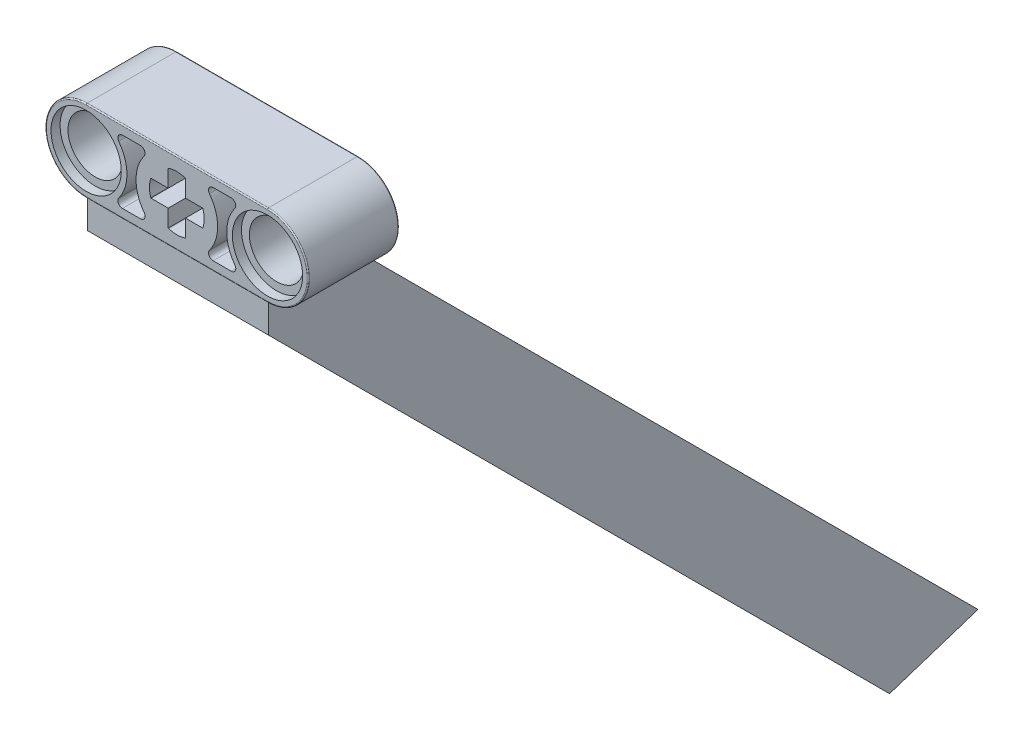
from build123d import *
from OCP.BRepAlgoAPI import BRepAlgoAPI_Cut
from OCP.TopTools import TopTools_ListOfShape

# Parameters (mm, degrees)
BOSS_EXTRUDE1_DEPTH   = 8
CUT_EXTRUDE2_DEPTH    = 3.1
CUT_EXTRUDE4_DEPTH    = 3.1
CUT_EXTRUDE6_START    = -3.1
CUT_EXTRUDE6_DEPTH    = 3.1
CUT_EXTRUDE7_START    = -3.1
CUT_EXTRUDE7_DEPTH    = 3.1
FILLET1_R             = 0.1
BODY_MOVE_COPY1_ANGLE = 89
BODY_MOVE_COPY3_ANGLE = 1
CUT_EXTRUDE8_DEPTH    = 19.406951047
CUT_EXTRUDE9_DEPTH    = 19.406951047
SKETCH20_W            = 16
SKETCH20_H            = 7.8
BOSS_EXTRUDE2_DEPTH   = 2.54
BOSS_EXTRUDE3_DEPTH   = 16


with BuildPart() as part:
    # Sketch1 → Boss-Extrude1 (new body)
    with BuildSketch(Plane.XY.offset(4)):
        with BuildLine():
            Line((-3.6, 0), (-3.6, -16))
            ThreePointArc((-3.6, -16), (0, -19.6), (3.6, -16))
            Line((3.6, -16), (3.6, 0))
            ThreePointArc((3.6, 0), (0, 3.6), (-3.6, 0))
        make_face()
    extrude(amount=-BOSS_EXTRUDE1_DEPTH)

    # Sketch3 → Cut-Extrude2 (cut)
    with BuildSketch(Plane.XY.offset(4)):
        with BuildLine():
            Line((2.8, -4.8), (2.8, -3.2))
            ThreePointArc((2.8, -3.2), (2.578885438, -2.842229124), (2.16, -2.88))
            ThreePointArc((2.16, -2.88), (0, -3.6), (-2.16, -2.88))
            ThreePointArc((-2.16, -2.88), (-2.578885438, -2.842229124), (-2.8, -3.2))
            Line((-2.8, -3.2), (-2.8, -4.8))
            ThreePointArc((-2.8, -4.8), (-2.578885438, -5.157770876), (-2.16, -5.12))
            ThreePointArc((-2.16, -5.12), (0, -4.4), (2.16, -5.12))
            ThreePointArc((2.16, -5.12), (2.578885438, -5.157770876), (2.8, -4.8))
        make_face()
    extrude(amount=-CUT_EXTRUDE2_DEPTH, mode=Mode.SUBTRACT)

    # Sketch5 → Cut-Extrude4 (cut)
    with BuildSketch(Plane.XY.offset(4)):
        with BuildLine():
            Line((2.8, -12.8), (2.8, -11.2))
            ThreePointArc((2.8, -11.2), (2.578885438, -10.842229124), (2.16, -10.88))
            ThreePointArc((2.16, -10.88), (0, -11.6), (-2.16, -10.88))
            ThreePointArc((-2.16, -10.88), (-2.578885438, -10.842229124), (-2.8, -11.2))
            Line((-2.8, -11.2), (-2.8, -12.8))
            ThreePointArc((-2.8, -12.8), (-2.578885438, -13.157770876), (-2.16, -13.12))
            ThreePointArc((-2.16, -13.12), (0, -12.4), (2.16, -13.12))
            ThreePointArc((2.16, -13.12), (2.578885438, -13.157770876), (2.8, -12.8))
        make_face()
    extrude(amount=-CUT_EXTRUDE4_DEPTH, mode=Mode.SUBTRACT)

    # Sketch7 → Cut-Extrude6 (cut)
    with BuildSketch(Plane(origin=(0, 0, -4), x_dir=(-1, 0, 0), z_dir=(0, 0, -1)).offset(CUT_EXTRUDE6_START)):
        with BuildLine():
            Line((2.8, -4.8), (2.8, -3.2))
            ThreePointArc((2.8, -3.2), (2.578885438, -2.842229124), (2.16, -2.88))
            ThreePointArc((2.16, -2.88), (0, -3.6), (-2.16, -2.88))
            ThreePointArc((-2.16, -2.88), (-2.578885438, -2.842229124), (-2.8, -3.2))
            Line((-2.8, -3.2), (-2.8, -4.8))
            ThreePointArc((-2.8, -4.8), (-2.578885438, -5.157770876), (-2.16, -5.12))
            ThreePointArc((-2.16, -5.12), (0, -4.4), (2.16, -5.12))
            ThreePointArc((2.16, -5.12), (2.578885438, -5.157770876), (2.8, -4.8))
        make_face()
    extrude(amount=CUT_EXTRUDE6_DEPTH, mode=Mode.SUBTRACT)

    # Sketch8 → Cut-Extrude7 (cut)
    with BuildSketch(Plane(origin=(0, 0, -4), x_dir=(-1, 0, 0), z_dir=(0, 0, -1)).offset(CUT_EXTRUDE7_START)):
        with BuildLine():
            Line((-2.8, -11.2), (-2.8, -12.8))
            ThreePointArc((-2.8, -12.8), (-2.578885438, -13.157770876), (-2.16, -13.12))
            ThreePointArc((-2.16, -13.12), (0, -12.4), (2.16, -13.12))
            ThreePointArc((2.16, -13.12), (2.578885438, -13.157770876), (2.8, -12.8))
            Line((2.8, -12.8), (2.8, -11.2))
            ThreePointArc((2.8, -11.2), (2.578885438, -10.842229124), (2.16, -10.88))
            ThreePointArc((2.16, -10.88), (0, -11.6), (-2.16, -10.88))
            ThreePointArc((-2.16, -10.88), (-2.578885438, -10.842229124), (-2.8, -11.2))
        make_face()
    extrude(amount=CUT_EXTRUDE7_DEPTH, mode=Mode.SUBTRACT)

    # Sketch10 → Cut-Revolve1 (revolve, cut)
    with BuildSketch(Plane(origin=(0, -16, 0), x_dir=(1, 0, 0), z_dir=(0, 1, 0))):
        Polygon((3.1, 4), (0, 4), (0, -4), (3.1, -4), (3.1, -3.2), (2.4, -3.2), (2.4, 3.2), (3.1, 3.2), align=None)
    revolve(axis=Axis((0, -16, -4), (0, 0, 1)), mode=Mode.SUBTRACT)

    # Sketch13 → Cut-Revolve4 (revolve, cut)
    with BuildSketch(Plane(origin=(0, 0, 0), x_dir=(1, 0, 0), z_dir=(0, 1, 0))):
        Polygon((3.1, 4), (0, 4), (0, -4), (3.1, -4), (3.1, -3.2), (2.4, -3.2), (2.4, 3.2), (3.1, 3.2), align=None)
    revolve(axis=Axis((0, 0, -4), (0, 0, 1)), mode=Mode.SUBTRACT)

    # Fillet1
    fillet1_edges = [part.edges().sort_by_distance(p)[0] for p in [
        (0, -19.6, -4),
        (3.6, -8, -4),
        (0, 3.6, -4),
        (3.6, -8, 4),
        (0, -19.6, 4),
        (-3.6, -8, 4),
        (0, 3.6, 4),
        (-3.6, -8, -4),
    ]]
    fillet(fillet1_edges, radius=FILLET1_R)


with BuildPart() as part_1:
    # Body-Move/Copy1: moved
    add(part.part.rotate(Axis((-1.61875778, -8, 0), (0, 0, 1)), BODY_MOVE_COPY1_ANGLE))


with BuildPart() as part_2:
    # Body-Move/Copy3: read off the stored shape, not the designer's step
    # Body-Move/Copy3: moved
    add(part_1.part.moved(Location((-0.0519755, -0.1124913, 0))).rotate(Axis((0, 0, 0), (0, 0, 1)), BODY_MOVE_COPY3_ANGLE))

    # Sketch14 → Cut-Extrude8 (cut, through all)
    with BuildSketch(Plane.XY.offset(4)):
        Polygon((-3.814896337, -5.759656314), (-3.814896337, -7.283656314), (-2.290892666, -7.283656314), (-2.290892666, -8.807656314), (-0.766892666, -8.807656314), (-0.766892666, -7.283656314), (0.757103663, -7.283656314), (0.757103663, -5.759656314), (-0.766892666, -5.759656314), (-0.766892666, -4.235656314), (-2.290892666, -4.235656314), (-2.290892666, -5.759656314), align=None)
    extrude(amount=-CUT_EXTRUDE8_DEPTH, mode=Mode.SUBTRACT)

    # Sketch15 → Cut-Extrude9 (cut, through all)
    with BuildSketch(Plane.XY.offset(4)):
        with BuildLine():
            Line((-2.290892666, -4.235656314), (-0.766892666, -4.235656314))
            Line((-0.766892666, -4.235656314), (-0.805995992, -4.222621872))
            ThreePointArc((-0.805995992, -4.222621872), (-1.528892666, -4.105311891), (-2.251789339, -4.222621872))
            Line((-2.251789339, -4.222621872), (-2.290892666, -4.235656314))
        make_face()
    extrude(amount=-CUT_EXTRUDE9_DEPTH, mode=Mode.SUBTRACT)


with BuildPart() as cirpattern1_tool:
    # CirPattern1: read off the stored shape, not the designer's step
    # CirPattern1: loft between two sections, ruled curve by curve
    cirpattern1_from = [
        Edge.make_three_point_arc((-3.827927108, -5.798759641, -4), (-3.945237088, -6.521656314, -4), (-3.827927108, -7.244552987, -4)),
        Edge.make_line((-3.827927108, -7.244552987, -4), (-3.814892666, -7.283656314, -4)),
        Edge.make_line((-3.827927108, -5.798759641, -4), (-3.814892666, -5.759656314, -4)),
        Edge.make_line((-3.814892666, -5.759656314, -4), (-3.814892666, -7.283656314, -4)),
    ]
    cirpattern1_to = [
        Edge.make_three_point_arc((-3.827927108, -5.798759641, 4), (-3.945237088, -6.521656314, 4), (-3.827927108, -7.244552987, 4)),
        Edge.make_line((-3.827927108, -7.244552987, 4), (-3.814892666, -7.283656314, 4)),
        Edge.make_line((-3.827927108, -5.798759641, 4), (-3.814892666, -5.759656314, 4)),
        Edge.make_line((-3.814892666, -5.759656314, 4), (-3.814892666, -7.283656314, 4)),
    ]
    cirpattern1 = Solid(Shell([*[Face.make_surface_from_curves(cirpattern1_from[k], cirpattern1_to[k]) for k in range(4)], Face(Wire(cirpattern1_from)), Face(Wire(cirpattern1_to))]))
    add(cirpattern1)


with BuildPart() as part_3:
    add(part_2.part)

    # CirPattern1: cut by cirpattern1_tool, with a tolerance
    cirpattern1_stock = TopTools_ListOfShape()
    cirpattern1_stock.Append(part_3.part.wrapped)
    cirpattern1_tools = TopTools_ListOfShape()
    cirpattern1_tools.Append(cirpattern1_tool.part.wrapped)
    cirpattern1_cut = BRepAlgoAPI_Cut()
    cirpattern1_cut.SetArguments(cirpattern1_stock)
    cirpattern1_cut.SetTools(cirpattern1_tools)
    cirpattern1_cut.SetFuzzyValue(0.00001)
    cirpattern1_cut.Build()
    add(Compound.cast(cirpattern1_cut.Shape()).solids(), mode=Mode.REPLACE)


with BuildPart() as cirpattern1_2_tool:
    # CirPattern1 2: loft between two sections, ruled curve by curve
    cirpattern1_2_from = [
        Edge.make_three_point_arc((-2.251789339, -8.820690756, -4), (-1.528892666, -8.938000737, -4), (-0.805995992, -8.820690756, -4)),
        Edge.make_line((-0.766892666, -8.807656314, -4), (-0.805995992, -8.820690756, -4)),
        Edge.make_line((-2.251789339, -8.820690756, -4), (-2.290892666, -8.807656314, -4)),
        Edge.make_line((-2.290892666, -8.807656314, -4), (-0.766892666, -8.807656314, -4)),
    ]
    cirpattern1_2_to = [
        Edge.make_three_point_arc((-2.251789339, -8.820690756, 4), (-1.528892666, -8.938000737, 4), (-0.805995992, -8.820690756, 4)),
        Edge.make_line((-0.766892666, -8.807656314, 4), (-0.805995992, -8.820690756, 4)),
        Edge.make_line((-2.251789339, -8.820690756, 4), (-2.290892666, -8.807656314, 4)),
        Edge.make_line((-2.290892666, -8.807656314, 4), (-0.766892666, -8.807656314, 4)),
    ]
    cirpattern1_2 = Solid(Shell([*[Face.make_surface_from_curves(cirpattern1_2_from[k], cirpattern1_2_to[k]) for k in range(4)], Face(Wire(cirpattern1_2_from)), Face(Wire(cirpattern1_2_to))]))
    add(cirpattern1_2)


with BuildPart() as part_4:
    add(part_3.part)

    # CirPattern1 2: cut by cirpattern1_2_tool, with a tolerance
    cirpattern1_2_stock = TopTools_ListOfShape()
    cirpattern1_2_stock.Append(part_4.part.wrapped)
    cirpattern1_2_tools = TopTools_ListOfShape()
    cirpattern1_2_tools.Append(cirpattern1_2_tool.part.wrapped)
    cirpattern1_2_cut = BRepAlgoAPI_Cut()
    cirpattern1_2_cut.SetArguments(cirpattern1_2_stock)
    cirpattern1_2_cut.SetTools(cirpattern1_2_tools)
    cirpattern1_2_cut.SetFuzzyValue(0.00001)
    cirpattern1_2_cut.Build()
    add(Compound.cast(cirpattern1_2_cut.Shape()).solids(), mode=Mode.REPLACE)


with BuildPart() as cirpattern1_3_tool:
    # CirPattern1 3: loft between two sections, ruled curve by curve
    cirpattern1_3_from = [
        Edge.make_three_point_arc((0.770141777, -7.244552987, -4), (0.887451757, -6.521656314, -4), (0.770141777, -5.798759641, -4)),
        Edge.make_line((0.757107334, -5.759656314, -4), (0.770141777, -5.798759641, -4)),
        Edge.make_line((0.770141777, -7.244552987, -4), (0.757103663, -7.283656314, -4)),
        Edge.make_line((0.757103663, -7.283656314, -4), (0.757107334, -5.759656314, -4)),
    ]
    cirpattern1_3_to = [
        Edge.make_three_point_arc((0.770141777, -7.244552987, 4), (0.887451757, -6.521656314, 4), (0.770141777, -5.798759641, 4)),
        Edge.make_line((0.757107334, -5.759656314, 4), (0.770141777, -5.798759641, 4)),
        Edge.make_line((0.770141777, -7.244552987, 4), (0.757107334, -7.283656314, 4)),
        Edge.make_line((0.757107334, -7.283656314, 4), (0.757107334, -5.759656314, 4)),
    ]
    cirpattern1_3 = Solid(Shell([*[Face.make_surface_from_curves(cirpattern1_3_from[k], cirpattern1_3_to[k]) for k in range(4)], Face(Wire(cirpattern1_3_from)), Face(Wire(cirpattern1_3_to))]))
    add(cirpattern1_3)


with BuildPart() as part_5:
    add(part_4.part)

    # CirPattern1 3: cut by cirpattern1_3_tool, with a tolerance
    cirpattern1_3_stock = TopTools_ListOfShape()
    cirpattern1_3_stock.Append(part_5.part.wrapped)
    cirpattern1_3_tools = TopTools_ListOfShape()
    cirpattern1_3_tools.Append(cirpattern1_3_tool.part.wrapped)
    cirpattern1_3_cut = BRepAlgoAPI_Cut()
    cirpattern1_3_cut.SetArguments(cirpattern1_3_stock)
    cirpattern1_3_cut.SetTools(cirpattern1_3_tools)
    cirpattern1_3_cut.SetFuzzyValue(0.00001)
    cirpattern1_3_cut.Build()
    add(Compound.cast(cirpattern1_3_cut.Shape()).solids(), mode=Mode.REPLACE)

    # Sketch20 → Boss-Extrude2 (add)
    with BuildSketch(Plane.XZ.offset(10.121656314)):
        with Locations((-1.528896337, 0)):
            Rectangle(SKETCH20_W, SKETCH20_H)
    extrude(amount=BOSS_EXTRUDE2_DEPTH)

    # Sketch23 → Boss-Extrude3 (add)
    with BuildSketch(Plane(origin=(6.471103663, 0, 0), x_dir=(0, 0, -1), z_dir=(1, 0, 0))):
        Polygon((-3.9, -12.661656314), (50.879562339, -67.441218652), (58.679562339, -64.901218652), (3.9, -10.121656314), align=None)
    extrude(amount=-BOSS_EXTRUDE3_DEPTH)


solid = part_5.part
